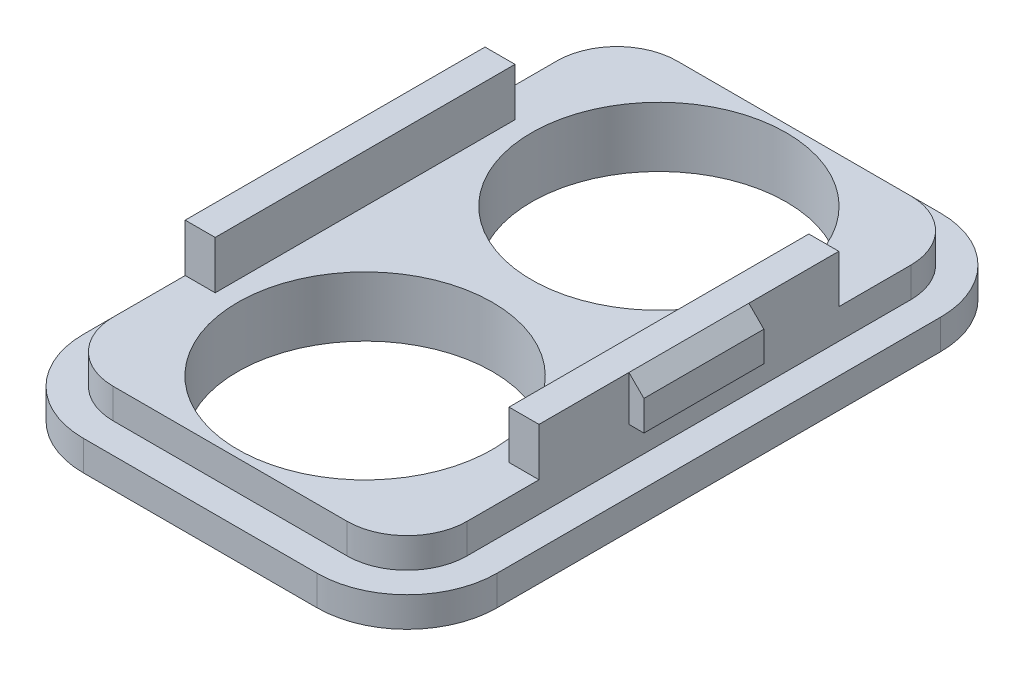
from build123d import *

# Parameters (mm, degrees)
EXTRUDE_1_DEPTH                           = 1
SKETCH_2_W                                = 1
SKETCH_2_H                                = 10
EXTRUDE_2_DEPTH                           = 1.6
EXTRUDE_3_DEPTH                           = 2
EXTRUDE_4_DEPTH                           = 1
MIRROR_1_AT_THE_SECOND_PLANE_COPY_1_DEPTH = 2
SKETCH_5_R                                = 4.25
CUT_EXTRUDE_1_DEPTH                       = 24.850366873


with BuildPart() as part:
    # 草图1 → 凸台-拉伸1 (new body)
    with BuildSketch(Plane(origin=(0, 0, 0), x_dir=(1, 0, 0), z_dir=(0, 1, 0))):
        with BuildLine():
            Line((2, 0), (9.8, 0))
            ThreePointArc((9.8, 0), (11.214213562, 0.585786438), (11.8, 2))
            Line((11.8, 2), (11.8, 16.8))
            ThreePointArc((11.8, 16.8), (11.214213562, 18.214213562), (9.8, 18.8))
            Line((9.8, 18.8), (2, 18.8))
            ThreePointArc((2, 18.8), (0.585786438, 18.214213562), (0, 16.8))
            Line((0, 16.8), (0, 2))
            ThreePointArc((0, 2), (0.585786438, 0.585786438), (2, 0))
        make_face()
    extrude(amount=EXTRUDE_1_DEPTH)

    # 草图2 → 凸台-拉伸2 (add)
    with BuildSketch(Plane(origin=(0, 1, 0), x_dir=(1, 0, 0), z_dir=(0, 1, 0))):
        with Locations((0.5, 9.4)):
            Rectangle(SKETCH_2_W, SKETCH_2_H)
        with Locations((11.3, 9.4)):
            Rectangle(SKETCH_2_W, SKETCH_2_H)
    extrude(amount=EXTRUDE_2_DEPTH)

    # 草图3 → 凸台-拉伸3 (add, symmetric)
    with BuildSketch(Plane.XY.offset(-9.4)):
        Polygon((0, 2.6), (0, 1.1), (-0.5, 1.1), (-0.5, 2.1), align=None)
    extrude_3 = extrude(amount=EXTRUDE_3_DEPTH, both=True)

    # 草图4 → 凸台-拉伸4 (add)
    with BuildSketch(Plane.XZ):
        with BuildLine():
            Line((2, -19.8), (9.8, -19.8))
            ThreePointArc((9.8, -19.8), (11.921320344, -18.921320344), (12.8, -16.8))
            Line((12.8, -16.8), (12.8, -2))
            ThreePointArc((12.8, -2), (11.921320344, 0.121320344), (9.8, 1))
            Line((9.8, 1), (2, 1))
            ThreePointArc((2, 1), (-0.121320344, 0.121320344), (-1, -2))
            Line((-1, -2), (-1, -16.8))
            ThreePointArc((-1, -16.8), (-0.121320344, -18.921320344), (2, -19.8))
        make_face()
    extrude(amount=EXTRUDE_4_DEPTH)

    # 镜向1: 凸台-拉伸3 across plane
    add(extrude_3.mirror(Plane.XY.offset(-9.4)))

    # 镜向1 at the second plane: 凸台-拉伸3 across plane
    add(extrude_3.mirror(Plane.ZY.offset(-5.9)))

    # 镜向1 at the second plane copy 1 sket → 镜向1 at the second plane copy 1 (add, symmetric)
    with BuildSketch(Plane(origin=(11.8, 0, -9.4), x_dir=(-1, 0, 0), z_dir=(0, 0, -1))):
        Polygon((0, 2.6), (0, 1.1), (-0.5, 1.1), (-0.5, 2.1), align=None)
    extrude(amount=MIRROR_1_AT_THE_SECOND_PLANE_COPY_1_DEPTH, both=True)

    # 草图5 → 切除-拉伸1 (cut, through all)
    with BuildSketch(Plane.XZ.offset(1)):
        with Locations((5.9, -4.5)):
            Circle(SKETCH_5_R)
        with Locations((5.9, -14.3)):
            Circle(SKETCH_5_R)
    extrude(amount=-CUT_EXTRUDE_1_DEPTH, mode=Mode.SUBTRACT)


solid = part.part
